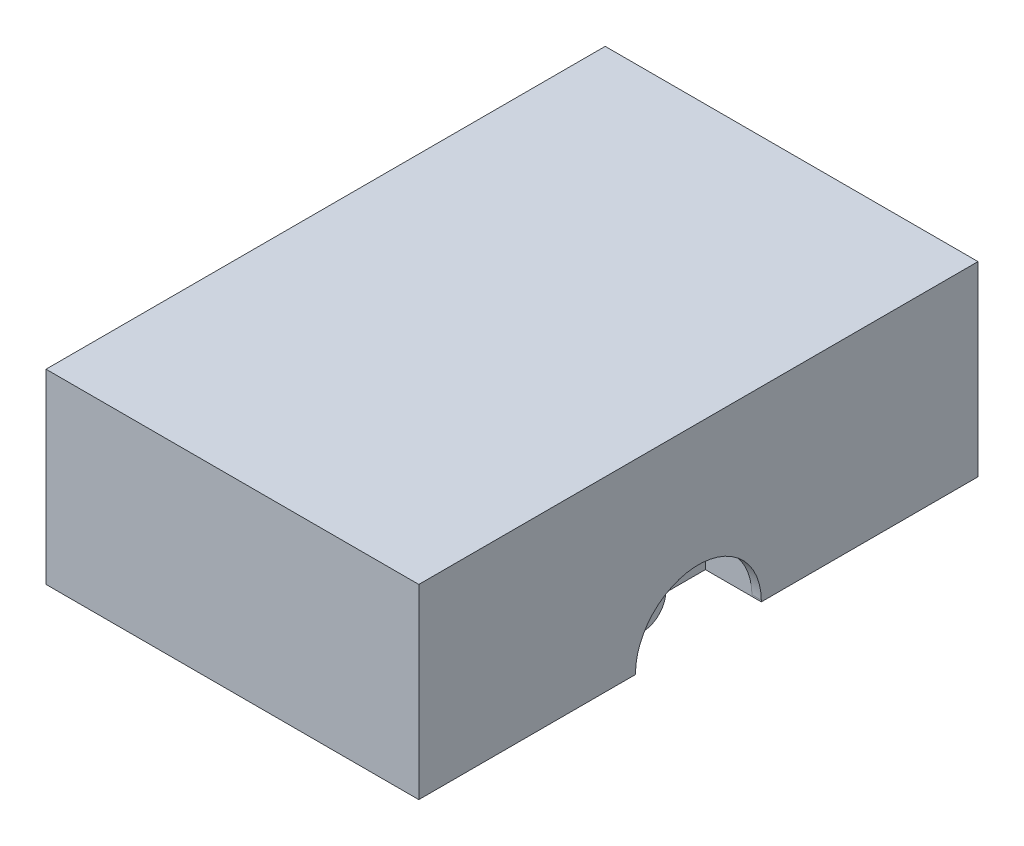
from build123d import *

# Parameters (mm, degrees)
SKETCH1_W                = 400
SKETCH1_H                = 200
BOSS_EXTRUDE1_DEPTH      = 600
SHELL1_T                 = -10
BOSS_EXTRUDE2_DEPTH      = 25
BOSS_EXTRUDE2_DEPTH_BACK = 10
SKETCH2_W                = 60
SKETCH2_H                = 60
SKETCH3_R                = 7.5
SKETCH3_R_2              = 5
BOSS_EXTRUDE3_DEPTH      = 15
LPATTERN1_COUNT          = 2
LPATTERN1_PITCH          = 330
LPATTERN1_COUNT_DIR2     = 2
LPATTERN1_PITCH_DIR2     = 530
SKETCH4_R                = 15
CUT_EXTRUDE1_DEPTH       = 749.331477355
BOSS_EXTRUDE4_START      = 15
SKETCH5_R                = 25
SKETCH5_R_2              = 15
BOSS_EXTRUDE4_DEPTH      = 15
THICKEN1_START           = 375
THICKEN1_OUTLINE_W       = 31
THICKEN1_OUTLINE_H       = 30
THICKEN1_DEPTH           = 0.5
THICKEN2_START           = 24.5
THICKEN2_OUTLINE_W       = 31
THICKEN2_OUTLINE_H       = 30
THICKEN2_DEPTH           = 0.5
BOSS_EXTRUDE6_REACH      = 737.941
SKETCH7_W                = 380
SKETCH7_H                = 580
SKETCH10_R               = 67.5
CUT_EXTRUDE2_DEPTH       = 60
SKETCH11_R               = 25
BOSS_EXTRUDE7_DEPTH      = 25
BOSS_EXTRUDE8_DEPTH      = 55
SKETCH11_4_R             = 15
CUT_EXTRUDE4_DEPTH       = 20


# Read off the part's stored shape, not the designer's step: Thicken1, Thicken2
with BuildPart() as part:
    # Sketch1 → Boss-Extrude1 (new body)
    with BuildSketch(Plane.XY):
        with Locations((200, 100)):
            Rectangle(SKETCH1_W, SKETCH1_H)
    extrude(amount=BOSS_EXTRUDE1_DEPTH)

    # Shell1
    shell1_openings = [part.faces().sort_by_distance(p)[0] for p in [
        (200, 0, 300),
    ]]
    offset(amount=SHELL1_T, openings=shell1_openings, kind=Kind.INTERSECTION)

    # Sketch2 → Boss-Extrude2 (add, two sides: drawn at the far end of the back side and taken through both)
    with BuildSketch(Plane(origin=(0, 28, 0), x_dir=(1, 0, 0), z_dir=(0, 1, 0)).offset(-BOSS_EXTRUDE2_DEPTH_BACK)):
        with Locations((370, -570)):
            Rectangle(SKETCH2_W, SKETCH2_H)
        with Locations((30, -570)):
            Rectangle(SKETCH2_W, SKETCH2_H)
        with Locations((370, -30)):
            Rectangle(SKETCH2_W, SKETCH2_H)
        with Locations((30, -30)):
            Rectangle(SKETCH2_W, SKETCH2_H)
    extrude(amount=BOSS_EXTRUDE2_DEPTH + BOSS_EXTRUDE2_DEPTH_BACK)

    # Sketch3 → Boss-Extrude3 (add)
    with BuildSketch(Plane(origin=(0, 18, 0), x_dir=(1, 0, 0), z_dir=(0, 1, 0))):
        with Locations(Location((35, -565, 0), (0, 0, 270))):
            Circle(SKETCH3_R)
        with Locations(Location((35, -565, 0), (0, 0, 270))):
            Circle(SKETCH3_R_2, mode=Mode.SUBTRACT)
    boss_extrude3 = extrude(amount=-BOSS_EXTRUDE3_DEPTH)

    # LPattern1: Boss-Extrude3 2 × 2
    with Locations(*[(i * LPATTERN1_PITCH, 0, -j * LPATTERN1_PITCH_DIR2) for i in range(LPATTERN1_COUNT) for j in range(LPATTERN1_COUNT_DIR2) if (i, j) != (0, 0)]):
        add(boss_extrude3)

    # Sketch4 → Cut-Extrude1 (cut, through all)
    with BuildSketch(Plane(origin=(0, 0, 0), x_dir=(0, 0, -1), z_dir=(1, 0, 0))):
        with Locations((-300, 0.8)):
            Circle(SKETCH4_R)
    extrude(amount=CUT_EXTRUDE1_DEPTH, mode=Mode.SUBTRACT)

    # Sketch5 → Boss-Extrude4 (add)
    with BuildSketch(Plane.ZY.offset(-390).offset(BOSS_EXTRUDE4_START)):
        with Locations(Location((300, 0.8, 0), (0, 0, 181.833778))):
            Circle(SKETCH5_R)
        with Locations((300, 0.8)):
            Circle(SKETCH5_R_2, mode=Mode.SUBTRACT)
    boss_extrude4 = extrude(amount=-BOSS_EXTRUDE4_DEPTH)

    # Thicken1 outline → Thicken1 (add)
    with BuildSketch(Plane.YZ.offset(THICKEN1_START)):
        with Locations((0.5, 300)):
            Rectangle(THICKEN1_OUTLINE_W, THICKEN1_OUTLINE_H)
    extrude(amount=THICKEN1_DEPTH)

    # Mirror5: Boss-Extrude4 across plane
    add(boss_extrude4.mirror(Plane(origin=(200, 0, 0), x_dir=(0, 0, 1), z_dir=(1, 0, 0))))

    # Thicken2 outline → Thicken2 (add)
    with BuildSketch(Plane.YZ.offset(THICKEN2_START)):
        with Locations((0.5, 300)):
            Rectangle(THICKEN2_OUTLINE_W, THICKEN2_OUTLINE_H)
    extrude(amount=THICKEN2_DEPTH)

    # Sketch7 → Boss-Extrude6 (add, up to next)
    with BuildSketch(Plane(origin=(0, 53, 0), x_dir=(1, 0, 0), z_dir=(0, 1, 0)), mode=Mode.PRIVATE) as boss_extrude6_sk1:
        with Locations((200, -300)):
            Rectangle(SKETCH7_W, SKETCH7_H)
    boss_extrude6_tool1 = extrude(boss_extrude6_sk1.sketch, amount=BOSS_EXTRUDE6_REACH, mode=Mode.PRIVATE) - part.part
    add(boss_extrude6_tool1.solids().sort_by_distance((200, 53, 300))[0])

    # Sketch10 → Cut-Extrude2 (cut)
    with BuildSketch(Plane(origin=(0, 0, 0), x_dir=(0, 0, -1), z_dir=(1, 0, 0))):
        with Locations((-300, 0.8)):
            Circle(SKETCH10_R)
    cut_extrude2 = extrude(amount=CUT_EXTRUDE2_DEPTH, mode=Mode.SUBTRACT)



with BuildPart() as body_2:
    # Sketch11 → Boss-Extrude7 (new body)
    with BuildSketch(Plane(origin=(60, 0, 0), x_dir=(0, 0, -1), z_dir=(1, 0, 0))):
        with Locations(Location((-300, 0.8, 0), (0, 0, 358.166222))):
            Circle(SKETCH11_R)
    boss_extrude7 = extrude(amount=BOSS_EXTRUDE7_DEPTH)


with BuildPart() as part_1:
    add(part.part)

    add(body_2.part)  # Boss-Extrude8 merges body 2
    # Sketch12 → Boss-Extrude8 (add)
    with BuildSketch(Plane.XZ):
        Polygon((0, 367.495259093), (60, 367.495259093), (60, 325), (60, 274.564639087), (60, 232.504740907), (0, 232.504740907), (0, 222.504740907), (70, 222.504740907), (70, 274.564639087), (70, 325), (70, 377.495259093), (0, 377.495259093), align=None)
    boss_extrude8 = extrude(amount=-BOSS_EXTRUDE8_DEPTH)

    # Sketch11<4> → Cut-Extrude4 (cut)
    with BuildSketch(Plane(origin=(60, 0, 0), x_dir=(0, 0, -1), z_dir=(1, 0, 0))):
        with Locations(Location((-300, 0.8, 0), (0, 0, 183.057225428))):
            Circle(SKETCH11_4_R)
    cut_extrude4 = extrude(amount=CUT_EXTRUDE4_DEPTH, mode=Mode.SUBTRACT)

    # Mirror7: Cut-Extrude2 across plane
    add(cut_extrude2.mirror(Plane(origin=(200, 0, 0), x_dir=(0, 0, 1), z_dir=(1, 0, 0))), mode=Mode.SUBTRACT)

    # Mirror10: Boss-Extrude8 across plane
    add(boss_extrude8.mirror(Plane(origin=(200, 0, 0), x_dir=(0, 0, 1), z_dir=(1, 0, 0))))

    # Mirror14: Boss-Extrude7 across plane
    add(boss_extrude7.mirror(Plane(origin=(200, 0, 0), x_dir=(0, 0, 1), z_dir=(1, 0, 0))))

    # Mirror15: Cut-Extrude4 across plane
    add(cut_extrude4.mirror(Plane(origin=(200, 0, 0), x_dir=(0, 0, 1), z_dir=(1, 0, 0))), mode=Mode.SUBTRACT)


solid = part_1.part
